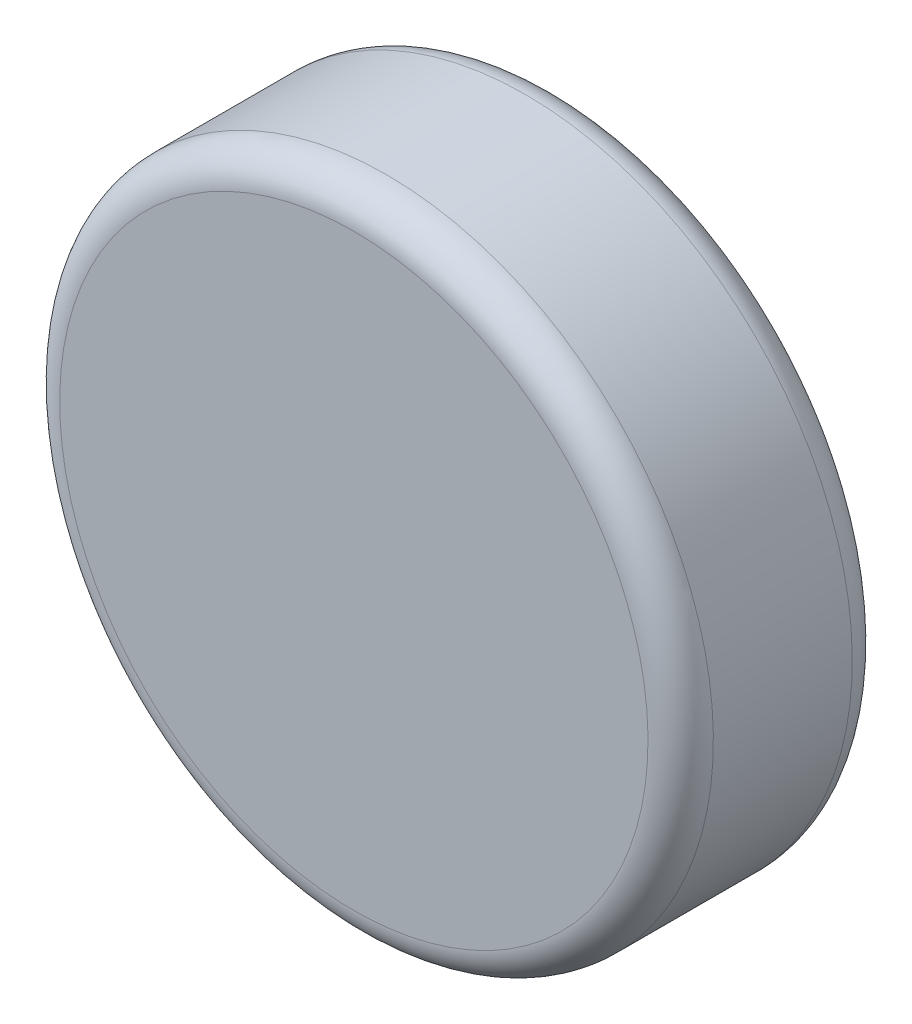
from build123d import *

# Parameters (mm, degrees)
SKETCH1_R           = 4
BOSS_EXTRUDE1_DEPTH = 2.5
FILLET1_R           = 0.4


with BuildPart() as part:
    # Sketch1 → Boss-Extrude1 (new body)
    with BuildSketch(Plane(origin=(0, 0, 15.895), x_dir=(-1, 0, 0), z_dir=(0, 0, -1))):
        with Locations((4.95, -15.400000468)):
            Circle(SKETCH1_R)
    extrude(amount=BOSS_EXTRUDE1_DEPTH)

    # Fillet1
    fillet1_edges = [part.edges().sort_by_distance(p)[0] for p in [
        (-0.95, -15.400000468, 15.895),
        (-0.95, -15.400000468, 13.395),
    ]]
    fillet(fillet1_edges, radius=FILLET1_R)


solid = part.part
